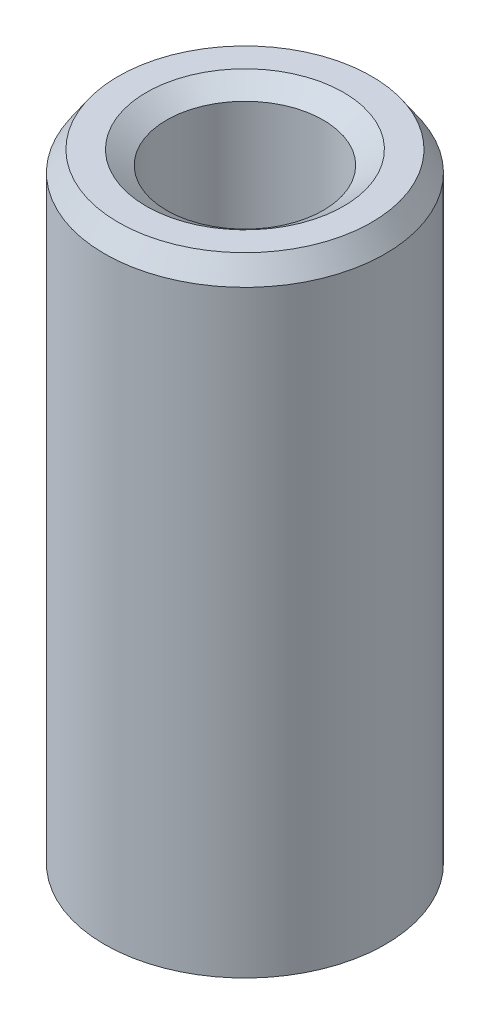
from build123d import *
from OCP.BRepFilletAPI import BRepFilletAPI_MakeChamfer

# Parameters (mm, degrees)
SKETCH1_R           = 10
BOSS_EXTRUDE1_DEPTH = 45.035832855
SKETCH2_R           = 5.579746119
CUT_EXTRUDE1_DEPTH  = 48.204091358
CHAMFER1_SIZE       = 1.446960173
CHAMFER1_SIZE2      = 0.979937343


with BuildPart() as part:
    # Sketch1 → Boss-Extrude1 (new body)
    with BuildSketch(Plane(origin=(0, 0, 0), x_dir=(1, 0, 0), z_dir=(0, 1, 0))):
        Circle(SKETCH1_R)
    extrude(amount=BOSS_EXTRUDE1_DEPTH)

    # Sketch2 → Cut-Extrude1 (cut, through all)
    with BuildSketch(Plane(origin=(0, 0, 0), x_dir=(1, 0, 0), z_dir=(0, 1, 0))):
        Circle(SKETCH2_R)
    extrude(amount=CUT_EXTRUDE1_DEPTH, mode=Mode.SUBTRACT)

    # Chamfer1: one chamfer whose edges measure the first distance from different faces: ONE call of the kernel's chamfer builder (chamfer() names one face for all edges)
    chamfer1_edges_1 = [part.edges().sort_by_distance(p)[0] for p in [
        (-5.579746119, 45.035832855, 0),
    ]]
    chamfer1_side_1 = [part.faces().sort_by_distance(p)[0] for p in [
        (-9.717157288, 45.035832855, 0),
    ]]
    chamfer1_edges_2 = [part.edges().sort_by_distance(p)[0] for p in [
        (-5.579746119, 0, 0),
    ]]
    chamfer1_side_2 = [part.faces().sort_by_distance(p)[0] for p in [
        (-5.579746119, 22.517916428, 0),
    ]]
    chamfer1_edges_3 = [part.edges().sort_by_distance(p)[0] for p in [
        (-10, 0, 0),
    ]]
    chamfer1_side_3 = [part.faces().sort_by_distance(p)[0] for p in [
        (-9.717157288, 0, 0),
    ]]
    chamfer1_edges_4 = [part.edges().sort_by_distance(p)[0] for p in [
        (-10, 45.035832855, 0),
    ]]
    chamfer1_side_4 = [part.faces().sort_by_distance(p)[0] for p in [
        (-10, 22.517916428, 0),
    ]]
    chamfer1 = BRepFilletAPI_MakeChamfer(part.part.solid().wrapped)
    for e in chamfer1_edges_1:
        chamfer1.Add(CHAMFER1_SIZE, CHAMFER1_SIZE2, e.wrapped, chamfer1_side_1[0].wrapped)  # the first distance lies on this face
    for e in chamfer1_edges_2:
        chamfer1.Add(CHAMFER1_SIZE, CHAMFER1_SIZE2, e.wrapped, chamfer1_side_2[0].wrapped)  # the first distance lies on this face
    for e in chamfer1_edges_3:
        chamfer1.Add(CHAMFER1_SIZE, CHAMFER1_SIZE2, e.wrapped, chamfer1_side_3[0].wrapped)  # the first distance lies on this face
    for e in chamfer1_edges_4:
        chamfer1.Add(CHAMFER1_SIZE, CHAMFER1_SIZE2, e.wrapped, chamfer1_side_4[0].wrapped)  # the first distance lies on this face
    add(Compound.cast(chamfer1.Shape()), mode=Mode.REPLACE)


solid = part.part
